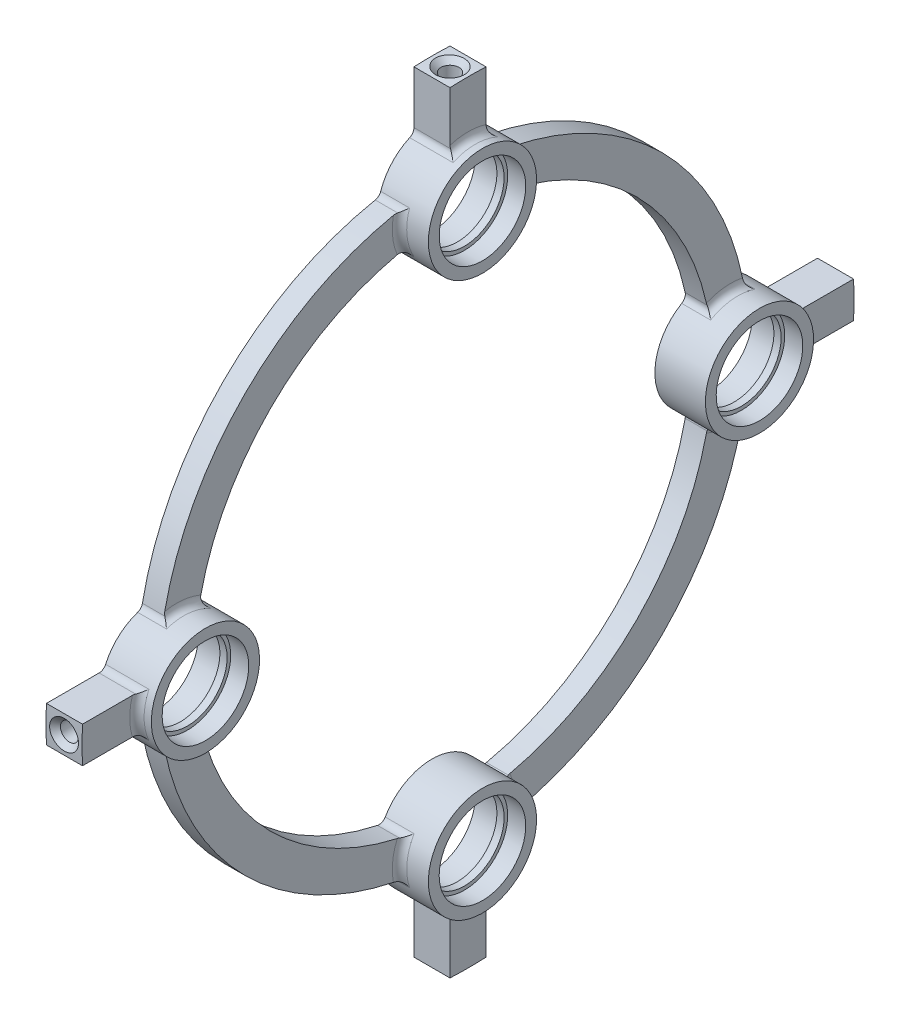
from build123d import *

# Parameters (mm, degrees)
SKETCH_1_R                       = 40.9
SKETCH_1_R_2                     = 35.9
EXTRUDE_1_DEPTH                  = 3
SKETCH_2_R                       = 7.5
EXTRUDE_2_DEPTH                  = 7
SKETCH_4_R                       = 5.5
CUT_EXTRUDE_1_DEPTH              = 62.875843429
SKETCH_5_R                       = 6
CUT_EXTRUDE_2_DEPTH              = 3.5
CUT_EXTRUDE_START                = -2.5
SKETCH_6_R                       = 6
CUT_EXTRUDE_3_DEPTH              = 2.5
EXTRUDE_3_DEPTH                  = 5
FILLET_1_R                       = 1
PATTERN_CIRCULAR_1_COUNT         = 4
FILLET_1_OF_PATTERN_CIRCULAR_1_R = 1


with BuildPart() as part:
    # Эскиз1 → Бобышка-Вытянуть1 (new body)
    with BuildSketch(Plane(origin=(0, 0, 0), x_dir=(0, 0, -1), z_dir=(1, 0, 0))):
        Circle(SKETCH_1_R)
        Circle(SKETCH_1_R_2, mode=Mode.SUBTRACT)
    extrude(amount=EXTRUDE_1_DEPTH)

    # Эскиз2 → Бобышка-Вытянуть2 (add)
    with BuildSketch(Plane.ZY):
        with Locations((0, 38.4)):
            Circle(SKETCH_2_R)
    extrude_2 = extrude(amount=-EXTRUDE_2_DEPTH)

    # Эскиз4 → Вырез-Вытянуть1 (cut, through all)
    with BuildSketch(Plane.ZY):
        with Locations((0, 38.4)):
            Circle(SKETCH_4_R)
    cut_extrude_1 = extrude(amount=-CUT_EXTRUDE_1_DEPTH, mode=Mode.SUBTRACT)

    # Эскиз5 → Вырез-Вытянуть2 (cut)
    with BuildSketch(Plane.ZY):
        with Locations((0, 38.4)):
            Circle(SKETCH_5_R)
    cut_extrude_2 = extrude(amount=-CUT_EXTRUDE_2_DEPTH, mode=Mode.SUBTRACT)

    # Эскиз6 → Вырез-Вытянуть3 (cut)
    with BuildSketch(Plane(origin=(7, 0, 0), x_dir=(0, 0, -1), z_dir=(1, 0, 0)).offset(CUT_EXTRUDE_START)):
        with Locations((0, 38.4)):
            Circle(SKETCH_6_R)
    cut_extrude_3 = extrude(amount=CUT_EXTRUDE_3_DEPTH, mode=Mode.SUBTRACT)

    # Эскиз7 → Бобышка-Вытянуть3 (add)
    with BuildSketch(Plane.ZY):
        with BuildLine():
            Line((-2.5, 53.441556864), (-2.5, 45.471067812))
            ThreePointArc((-2.5, 45.471067812), (0, 45.9), (2.5, 45.471067812))
            Line((2.5, 45.471067812), (2.5, 53.441556864))
            ThreePointArc((2.5, 53.441556864), (0, 53.5), (-2.5, 53.441556864))
        make_face()
    extrude_3 = extrude(amount=-EXTRUDE_3_DEPTH)

    # Скругление1
    fillet_1_edges = [part.edges().sort_by_distance(p)[0] for p in [
        (3, 36.786713686, 7.324432215),
        (3, 37.709096353, -7.468109008),
        (1.5, 35.248958333, -6.805948605),
        (1.5, 35.248958333, 6.805948605),
        (1.5, 40.248958333, 7.268517943),
        (1.5, 40.248958333, -7.268517943),
        (5, 45.9, 0),
        (2.5, 45.471067812, 2.5),
        (2.5, 45.471067812, -2.5),
    ]]
    fillet(fillet_1_edges, radius=FILLET_1_R)

    # Эскиз8 → Отверстие обработанное метчиком M31 (revolve, cut)
    with BuildSketch(Plane(origin=(2.5, 53.5, 0), x_dir=(0, 0, 1), z_dir=(1, 0, 0))):
        Polygon((0, 0), (0, 7.751075774), (1.25, 7), (1.25, 0.75), (2, 0), align=None)
    hole_wizard_m31 = revolve(axis=Axis((2.5, 59.85, 0), (0, -1, 0)), mode=Mode.SUBTRACT)

    # Круговой массив1: Бобышка-Вытянуть2, Вырез-Вытянуть1, Вырез-Вытянуть2, Вырез-Вытянуть3, Бобышка-Вытянуть3, Отверстие обработанное метчиком M31 ×4 about axis
    pattern_circular_1_axis = Axis((3, 0, 0), (-1, 0, 0))
    add([extrude_2.rotate(pattern_circular_1_axis, i * 360 / PATTERN_CIRCULAR_1_COUNT) for i in range(1, PATTERN_CIRCULAR_1_COUNT)])
    add([cut_extrude_1.rotate(pattern_circular_1_axis, i * 360 / PATTERN_CIRCULAR_1_COUNT) for i in range(1, PATTERN_CIRCULAR_1_COUNT)], mode=Mode.SUBTRACT)
    add([cut_extrude_2.rotate(pattern_circular_1_axis, i * 360 / PATTERN_CIRCULAR_1_COUNT) for i in range(1, PATTERN_CIRCULAR_1_COUNT)], mode=Mode.SUBTRACT)
    add([cut_extrude_3.rotate(pattern_circular_1_axis, i * 360 / PATTERN_CIRCULAR_1_COUNT) for i in range(1, PATTERN_CIRCULAR_1_COUNT)], mode=Mode.SUBTRACT)
    add([extrude_3.rotate(pattern_circular_1_axis, i * 360 / PATTERN_CIRCULAR_1_COUNT) for i in range(1, PATTERN_CIRCULAR_1_COUNT)])
    add([hole_wizard_m31.rotate(pattern_circular_1_axis, i * 360 / PATTERN_CIRCULAR_1_COUNT) for i in range(1, PATTERN_CIRCULAR_1_COUNT)], mode=Mode.SUBTRACT)

    # Скругление1 of Круговой массив1
    fillet_1_of_pattern_circular_1_edges = [part.edges().sort_by_distance(p)[0] for p in [
        (3, 7.324432215, -36.786713686),
        (3, -7.468109008, -37.709096353),
        (1.5, -6.805948605, -35.248958333),
        (1.5, 6.805948605, -35.248958333),
        (1.5, 7.268517943, -40.248958333),
        (1.5, -7.268517943, -40.248958333),
        (5, 0, -45.9),
        (2.5, 2.5, -45.471067812),
        (2.5, -2.5, -45.471067812),
        (3, -36.786713686, -7.324432215),
        (3, -37.709096353, 7.468109008),
        (1.5, -35.248958333, 6.805948605),
        (1.5, -35.248958333, -6.805948605),
        (1.5, -40.248958333, -7.268517943),
        (1.5, -40.248958333, 7.268517943),
        (5, -45.9, 0),
        (2.5, -45.471067812, -2.5),
        (2.5, -45.471067812, 2.5),
        (3, -7.324432215, 36.786713686),
        (3, 7.468109008, 37.709096353),
        (1.5, 6.805948605, 35.248958333),
        (1.5, -6.805948605, 35.248958333),
        (1.5, -7.268517943, 40.248958333),
        (1.5, 7.268517943, 40.248958333),
        (5, 0, 45.9),
        (2.5, -2.5, 45.471067812),
        (2.5, 2.5, 45.471067812),
    ]]
    fillet(fillet_1_of_pattern_circular_1_edges, radius=FILLET_1_OF_PATTERN_CIRCULAR_1_R)


solid = part.part
